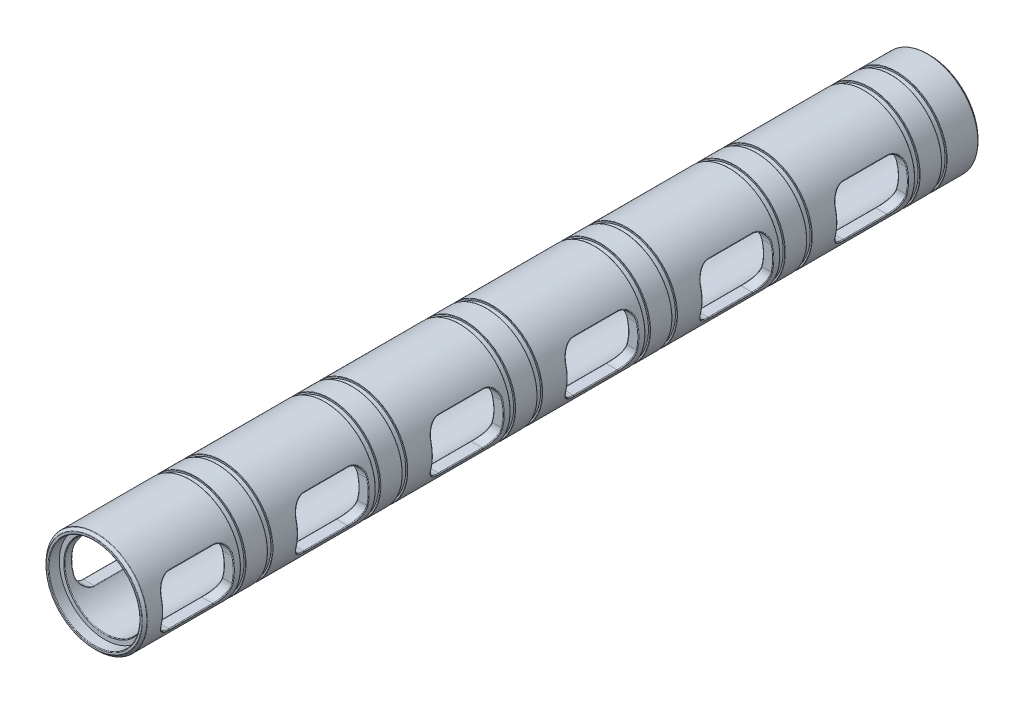
from build123d import *

# Parameters (mm, degrees)
SKETCH1_R              = 15
SKETCH1_R_2            = 12
EXTRUDE1_DEPTH         = 248
SKETCH2_R              = 13.5
CUT_EXTRUDE1_DEPTH     = 3.2
CUT_EXTRUDE2_START     = -3.2
SKETCH3_R              = 13.5
CUT_EXTRUDE2_DEPTH     = 3.2
CHAMFER1_SIZE          = 0.75
FILLET1_R              = 0.2
CUT_EXTRUDE3_START     = -10
SKETCH5_R              = 15
SKETCH5_R_2            = 14.5
CUT_EXTRUDE3_DEPTH     = 1.5
CUT_EXTRUDE4_START     = -18
SKETCH6_R              = 15
SKETCH6_R_2            = 14.5
CUT_EXTRUDE4_DEPTH     = 1.5
FILLET2_R              = 0.1
CUT_EXTRUDE5_START     = -20
CUT_EXTRUDE5_DEPTH     = 269.905604603
FILLET3_R              = 0.2
FILLET4_R              = 0.2
LPATTERN1_COUNT        = 6
LPATTERN1_PITCH        = 40
FILLET2_OF_LPATTERN1_R = 0.1
FILLET3_OF_LPATTERN1_R = 0.2


with BuildPart() as part:
    # Sketch1 → Extrude1 (new body)
    with BuildSketch(Plane.XY):
        Circle(SKETCH1_R)
        Circle(SKETCH1_R_2, mode=Mode.SUBTRACT)
    extrude(amount=EXTRUDE1_DEPTH)

    # Sketch2 → Cut-Extrude1 (cut)
    with BuildSketch(Plane.XY.offset(248)):
        Circle(SKETCH2_R)
    extrude(amount=-CUT_EXTRUDE1_DEPTH, mode=Mode.SUBTRACT)

    # Sketch3 → Cut-Extrude2 (cut)
    with BuildSketch(Plane(origin=(0, 0, 0), x_dir=(-1, 0, 0), z_dir=(0, 0, -1)).offset(CUT_EXTRUDE2_START)):
        with Locations(Location((0, 0, 0), (0, 0, 180))):
            Circle(SKETCH3_R)
    extrude(amount=CUT_EXTRUDE2_DEPTH, mode=Mode.SUBTRACT)

    # Chamfer1
    chamfer1_edges = [part.edges().sort_by_distance(p)[0] for p in [
        (-15, 0, 0),
        (-15, 0, 248),
    ]]
    chamfer(chamfer1_edges, length=CHAMFER1_SIZE)

    # Fillet1
    fillet1_edges = [part.edges().sort_by_distance(p)[0] for p in [
        (-12, 0, 244.8),
        (-13.5, 0, 248),
        (-12, 0, 3.2),
        (-13.5, 0, 0),
    ]]
    fillet(fillet1_edges, radius=FILLET1_R)

    # Sketch5 → Cut-Extrude3 (cut)
    with BuildSketch(Plane(origin=(0, 0, 0), x_dir=(-1, 0, 0), z_dir=(0, 0, -1)).offset(CUT_EXTRUDE3_START)):
        Circle(SKETCH5_R)
        Circle(SKETCH5_R_2, mode=Mode.SUBTRACT)
    cut_extrude3 = extrude(amount=-CUT_EXTRUDE3_DEPTH, mode=Mode.SUBTRACT)

    # Sketch6 → Cut-Extrude4 (cut)
    with BuildSketch(Plane(origin=(0, 0, 0), x_dir=(-1, 0, 0), z_dir=(0, 0, -1)).offset(CUT_EXTRUDE4_START)):
        Circle(SKETCH6_R)
        Circle(SKETCH6_R_2, mode=Mode.SUBTRACT)
    cut_extrude4 = extrude(amount=-CUT_EXTRUDE4_DEPTH, mode=Mode.SUBTRACT)

    # Fillet2
    fillet2_edges = [part.edges().sort_by_distance(p)[0] for p in [
        (-15, 0, 10),
        (-15, 0, 11.5),
        (-15, 0, 19.5),
        (-15, 0, 18),
    ]]
    fillet(fillet2_edges, radius=FILLET2_R)

    # Sketch7 → Cut-Extrude5 (cut, through all)
    with BuildSketch(Plane(origin=(0, 0, 0), x_dir=(0, 0, -1), z_dir=(1, 0, 0)).offset(CUT_EXTRUDE5_START)):
        with BuildLine():
            Line((-38.5, 7.5), (-25.5, 7.5))
            ThreePointArc((-25.5, 7.5), (-22.671572875, 6.328427125), (-21.5, 3.5))
            Line((-21.5, 3.5), (-21.5, -3.5))
            ThreePointArc((-21.5, -3.5), (-22.671572875, -6.328427125), (-25.5, -7.5))
            Line((-25.5, -7.5), (-38.5, -7.5))
            ThreePointArc((-38.5, -7.5), (-41.328427125, -6.328427125), (-42.5, -3.5))
            Line((-42.5, -3.5), (-42.5, 3.5))
            ThreePointArc((-42.5, 3.5), (-41.328427125, 6.328427125), (-38.5, 7.5))
        make_face()
    cut_extrude5 = extrude(amount=CUT_EXTRUDE5_DEPTH, mode=Mode.SUBTRACT)

    # Fillet3
    fillet3_edges = [part.edges().sort_by_distance(p)[0] for p in [
        (9.367496998, 7.5, 32),
        (10.220231108, 6.288630698, 22.632328676),
        (11.868843318, -1.769338379, 21.5),
        (10.220231123, -6.28863071, 22.632328677),
        (9.367496998, -7.5, 32),
        (10.220231108, -6.288630698, 41.367671324),
        (11.868843318, -1.769338379, 42.5),
        (11.868843318, 1.769338379, 42.5),
        (-9.367496998, 7.5, 32),
        (-10.220231108, 6.288630698, 22.632328676),
        (-12, 0, 21.5),
        (-10.220231123, -6.28863071, 22.632328677),
        (-9.367496998, -7.5, 32),
        (-10.220231108, -6.288630698, 41.367671324),
        (-12, 0, 42.5),
        (-10.220231108, 6.288630698, 41.367671324),
        (-13.612116888, 6.301608831, 41.354993509),
        (14.896128393, -1.762202856, 42.5),
        (-13.612116883, -6.301608839, 41.354993518),
        (12.990381057, -7.5, 32),
        (-13.612116888, -6.301608831, 22.645006491),
        (14.896128393, -1.762202856, 21.5),
        (-13.612116883, 6.301608839, 22.645006482),
        (-12.990381057, 7.5, 32),
        (14.896128393, 1.762202856, 42.5),
        (-15, 0, 42.5),
        (13.612116883, -6.301608839, 41.354993518),
        (-12.990381057, -7.5, 32),
        (13.612116888, -6.301608831, 22.645006491),
        (-15, 0, 21.5),
        (13.612116883, 6.301608839, 22.645006482),
        (12.990381057, 7.5, 32),
    ]]
    fillet(fillet3_edges, radius=FILLET3_R)

    # Fillet4
    fillet4_edges = [part.edges().sort_by_distance(p)[0] for p in [
        (-14.25, 0, 248),
        (-15, 0, 0.75),
        (-15, 0, 247.25),
        (-14.25, 0, 0),
    ]]
    fillet(fillet4_edges, radius=FILLET4_R)

    # LPattern1: Cut-Extrude3, Cut-Extrude4, Cut-Extrude5 ×6
    with Locations(*[(0, 0, i * LPATTERN1_PITCH) for i in range(1, LPATTERN1_COUNT)]):
        add(cut_extrude3, mode=Mode.SUBTRACT)
        add(cut_extrude4, mode=Mode.SUBTRACT)
        add(cut_extrude5, mode=Mode.SUBTRACT)

    # Fillet2 of LPattern1
    fillet2_of_lpattern1_edges = [part.edges().sort_by_distance(p)[0] for p in [
        (-15, 0, 50),
        (-15, 0, 51.5),
        (-15, 0, 59.5),
        (-15, 0, 58),
        (-15, 0, 90),
        (-15, 0, 91.5),
        (-15, 0, 99.5),
        (-15, 0, 98),
        (-15, 0, 130),
        (-15, 0, 131.5),
        (-15, 0, 139.5),
        (-15, 0, 138),
        (-15, 0, 170),
        (-15, 0, 171.5),
        (-15, 0, 179.5),
        (-15, 0, 178),
        (-15, 0, 210),
        (-15, 0, 211.5),
        (-15, 0, 219.5),
        (-15, 0, 218),
    ]]
    fillet(fillet2_of_lpattern1_edges, radius=FILLET2_OF_LPATTERN1_R)

    # Fillet3 of LPattern1
    fillet3_of_lpattern1_edges = [part.edges().sort_by_distance(p)[0] for p in [
        (9.367496998, 7.5, 72),
        (10.220231108, 6.288630698, 62.632328676),
        (11.868843318, -1.769338379, 61.5),
        (10.220231123, -6.28863071, 62.632328677),
        (9.367496998, -7.5, 72),
        (10.220231108, -6.288630698, 81.367671324),
        (11.868843318, -1.769338379, 82.5),
        (11.868843318, 1.769338379, 82.5),
        (-9.367496998, 7.5, 72),
        (-10.220231108, 6.288630698, 62.632328676),
        (-12, 0, 61.5),
        (-10.220231123, -6.28863071, 62.632328677),
        (-9.367496998, -7.5, 72),
        (-10.220231108, -6.288630698, 81.367671324),
        (-12, 0, 82.5),
        (-10.220231108, 6.288630698, 81.367671324),
        (-13.612116888, 6.301608831, 81.354993509),
        (14.896128393, -1.762202856, 82.5),
        (-13.612116883, -6.301608839, 81.354993518),
        (12.990381057, -7.5, 72),
        (-13.612116888, -6.301608831, 62.645006491),
        (14.896128393, -1.762202856, 61.5),
        (-13.612116883, 6.301608839, 62.645006482),
        (-12.990381057, 7.5, 72),
        (14.896128393, 1.762202856, 82.5),
        (-15, 0, 82.5),
        (13.612116883, -6.301608839, 81.354993518),
        (-12.990381057, -7.5, 72),
        (13.612116888, -6.301608831, 62.645006491),
        (-15, 0, 61.5),
        (13.612116883, 6.301608839, 62.645006482),
        (12.990381057, 7.5, 72),
        (9.367496998, 7.5, 112),
        (10.220231108, 6.288630698, 102.632328676),
        (11.868843318, -1.769338379, 101.5),
        (10.220231123, -6.28863071, 102.632328677),
        (9.367496998, -7.5, 112),
        (10.220231108, -6.288630698, 121.367671324),
        (11.868843318, -1.769338379, 122.5),
        (11.868843318, 1.769338379, 122.5),
        (-9.367496998, 7.5, 112),
        (-10.220231108, 6.288630698, 102.632328676),
        (-12, 0, 101.5),
        (-10.220231123, -6.28863071, 102.632328677),
        (-9.367496998, -7.5, 112),
        (-10.220231108, -6.288630698, 121.367671324),
        (-12, 0, 122.5),
        (-10.220231108, 6.288630698, 121.367671324),
        (-13.612116888, 6.301608831, 121.354993509),
        (14.896128393, -1.762202856, 122.5),
        (-13.612116883, -6.301608839, 121.354993518),
        (12.990381057, -7.5, 112),
        (-13.612116888, -6.301608831, 102.645006491),
        (14.896128393, -1.762202856, 101.5),
        (-13.612116883, 6.301608839, 102.645006482),
        (-12.990381057, 7.5, 112),
        (14.896128393, 1.762202856, 122.5),
        (-15, 0, 122.5),
        (13.612116883, -6.301608839, 121.354993518),
        (-12.990381057, -7.5, 112),
        (13.612116888, -6.301608831, 102.645006491),
        (-15, 0, 101.5),
        (13.612116883, 6.301608839, 102.645006482),
        (12.990381057, 7.5, 112),
        (9.367496998, 7.5, 152),
        (10.220231108, 6.288630698, 142.632328676),
        (11.868843318, -1.769338379, 141.5),
        (10.220231123, -6.28863071, 142.632328677),
        (9.367496998, -7.5, 152),
        (10.220231108, -6.288630698, 161.367671324),
        (11.868843318, -1.769338379, 162.5),
        (11.868843318, 1.769338379, 162.5),
        (-9.367496998, 7.5, 152),
        (-10.220231108, 6.288630698, 142.632328676),
        (-12, 0, 141.5),
        (-10.220231123, -6.28863071, 142.632328677),
        (-9.367496998, -7.5, 152),
        (-10.220231108, -6.288630698, 161.367671324),
        (-12, 0, 162.5),
        (-10.220231108, 6.288630698, 161.367671324),
        (-13.612116888, 6.301608831, 161.354993509),
        (14.896128393, -1.762202856, 162.5),
        (-13.612116883, -6.301608839, 161.354993518),
        (12.990381057, -7.5, 152),
        (-13.612116888, -6.301608831, 142.645006491),
        (14.896128393, -1.762202856, 141.5),
        (-13.612116883, 6.301608839, 142.645006482),
        (-12.990381057, 7.5, 152),
        (14.896128393, 1.762202856, 162.5),
        (-15, 0, 162.5),
        (13.612116883, -6.301608839, 161.354993518),
        (-12.990381057, -7.5, 152),
        (13.612116888, -6.301608831, 142.645006491),
        (-15, 0, 141.5),
        (13.612116883, 6.301608839, 142.645006482),
        (12.990381057, 7.5, 152),
        (9.367496998, 7.5, 192),
        (10.220231108, 6.288630698, 182.632328676),
        (11.868843318, -1.769338379, 181.5),
        (10.220231123, -6.28863071, 182.632328677),
        (9.367496998, -7.5, 192),
        (10.220231108, -6.288630698, 201.367671324),
        (11.868843318, -1.769338379, 202.5),
        (11.868843318, 1.769338379, 202.5),
        (-9.367496998, 7.5, 192),
        (-10.220231108, 6.288630698, 182.632328676),
        (-12, 0, 181.5),
        (-10.220231123, -6.28863071, 182.632328677),
        (-9.367496998, -7.5, 192),
        (-10.220231108, -6.288630698, 201.367671324),
        (-12, 0, 202.5),
        (-10.220231108, 6.288630698, 201.367671324),
        (-13.612116888, 6.301608831, 201.354993509),
        (14.896128393, -1.762202856, 202.5),
        (-13.612116883, -6.301608839, 201.354993518),
        (12.990381057, -7.5, 192),
        (-13.612116888, -6.301608831, 182.645006491),
        (14.896128393, -1.762202856, 181.5),
        (-13.612116883, 6.301608839, 182.645006482),
        (-12.990381057, 7.5, 192),
        (14.896128393, 1.762202856, 202.5),
        (-15, 0, 202.5),
        (13.612116883, -6.301608839, 201.354993518),
        (-12.990381057, -7.5, 192),
        (13.612116888, -6.301608831, 182.645006491),
        (-15, 0, 181.5),
        (13.612116883, 6.301608839, 182.645006482),
        (12.990381057, 7.5, 192),
        (9.367496998, 7.5, 232),
        (10.220231108, 6.288630698, 222.632328676),
        (11.868843318, -1.769338379, 221.5),
        (10.220231123, -6.28863071, 222.632328677),
        (9.367496998, -7.5, 232),
        (10.220231108, -6.288630698, 241.367671324),
        (11.868843318, -1.769338379, 242.5),
        (11.868843318, 1.769338379, 242.5),
        (-9.367496998, 7.5, 232),
        (-10.220231108, 6.288630698, 222.632328676),
        (-12, 0, 221.5),
        (-10.220231123, -6.28863071, 222.632328677),
        (-9.367496998, -7.5, 232),
        (-10.220231108, -6.288630698, 241.367671324),
        (-12, 0, 242.5),
        (-10.220231108, 6.288630698, 241.367671324),
        (-13.612116888, 6.301608831, 241.354993509),
        (14.896128393, -1.762202856, 242.5),
        (-13.612116883, -6.301608839, 241.354993518),
        (12.990381057, -7.5, 232),
        (-13.612116888, -6.301608831, 222.645006491),
        (14.896128393, -1.762202856, 221.5),
        (-13.612116883, 6.301608839, 222.645006482),
        (-12.990381057, 7.5, 232),
        (14.896128393, 1.762202856, 242.5),
        (-15, 0, 242.5),
        (13.612116883, -6.301608839, 241.354993518),
        (-12.990381057, -7.5, 232),
        (13.612116888, -6.301608831, 222.645006491),
        (-15, 0, 221.5),
        (13.612116883, 6.301608839, 222.645006482),
        (12.990381057, 7.5, 232),
    ]]
    fillet(fillet3_of_lpattern1_edges, radius=FILLET3_OF_LPATTERN1_R)


solid = part.part
